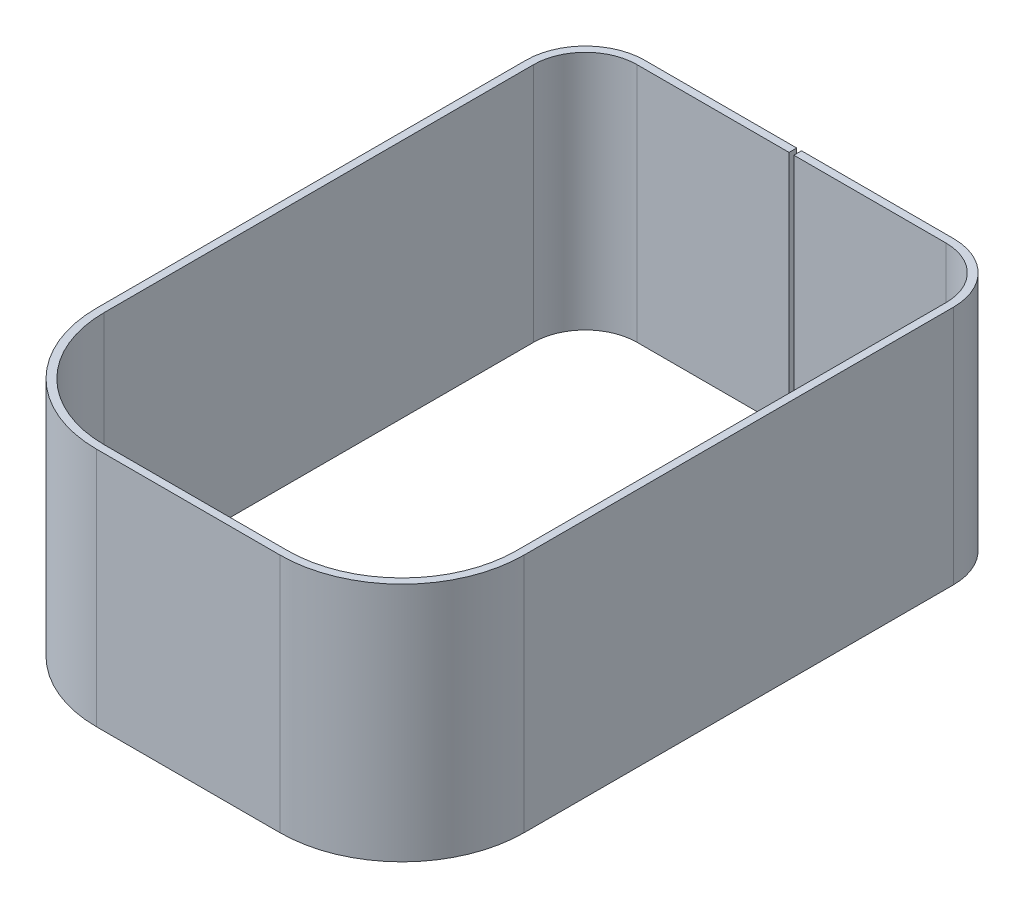
from build123d import *

# Parameters (mm, degrees)
EXTRUDE_THIN1_DEPTH  = 30
CONVERT_SOLID1_START = -20
CONVERT_SOLID1_DEPTH = 20


# Read off the part's stored shape, not the designer's step: Convert-Solid1
with BuildPart() as part:
    # Sketch1 → Extrude-Thin1 (new body)
    with BuildSketch(Plane(origin=(0, 0, 0), x_dir=(1, 0, 0), z_dir=(0, 1, 0))):
        with BuildLine():
            Line((0.5, 63.5), (32.11260948, 63.5))
            ThreePointArc((32.11260948, 63.5), (40.836461979, 59.886461979), (44.45, 51.16260948))
            Line((44.45, 51.16260948), (44.45, -38.1))
            ThreePointArc((44.45, -38.1), (37.010512242, -56.060512242), (19.05, -63.5))
            Line((19.05, -63.5), (-19.05, -63.5))
            ThreePointArc((-19.05, -63.5), (-37.010512242, -56.060512242), (-44.45, -38.1))
            Line((-44.45, -38.1), (-44.45, 51.16260948))
            ThreePointArc((-44.45, 51.16260948), (-40.836461979, 59.886461979), (-32.11260948, 63.5))
            Line((-32.11260948, 63.5), (-0.5, 63.5))
            Line((-0.5, 63.5), (-0.5, 61.9125))
            Line((-0.5, 61.9125), (-32.11260948, 61.9125))
            ThreePointArc((-32.11260948, 61.9125), (-39.713929964, 58.763929964), (-42.8625, 51.16260948))
            Line((-42.8625, 51.16260948), (-42.8625, -38.1))
            ThreePointArc((-42.8625, -38.1), (-35.887980227, -54.937980227), (-19.05, -61.9125))
            Line((-19.05, -61.9125), (19.05, -61.9125))
            ThreePointArc((19.05, -61.9125), (35.887980227, -54.937980227), (42.8625, -38.1))
            Line((42.8625, -38.1), (42.8625, 51.16260948))
            ThreePointArc((42.8625, 51.16260948), (39.713929964, 58.763929964), (32.11260948, 61.9125))
            Line((32.11260948, 61.9125), (0.5, 61.9125))
            Line((0.5, 61.9125), (0.5, 63.5))
        make_face()
    extrude(amount=EXTRUDE_THIN1_DEPTH)

    # Convert-Solid1 outline → Convert-Solid1 (add)
    with BuildSketch(Plane(origin=(0, 0, 0), x_dir=(1, 0, 0), z_dir=(0, 1, 0)).offset(CONVERT_SOLID1_START)):
        with BuildLine():
            Line((0.5, 61.9125), (32.11260948, 61.9125))
            ThreePointArc((32.11260948, 61.9125), (39.713929964, 58.763929964), (42.8625, 51.16260948))
            Line((42.8625, 51.16260948), (42.8625, -38.1))
            ThreePointArc((42.8625, -38.1), (35.887980227, -54.937980227), (19.05, -61.9125))
            Line((19.05, -61.9125), (-19.05, -61.9125))
            ThreePointArc((-19.05, -61.9125), (-35.887980227, -54.937980227), (-42.8625, -38.1))
            Line((-42.8625, -38.1), (-42.8625, 51.16260948))
            ThreePointArc((-42.8625, 51.16260948), (-39.713929964, 58.763929964), (-32.11260948, 61.9125))
            Line((-32.11260948, 61.9125), (-0.5, 61.9125))
            Line((-0.5, 61.9125), (-0.5, 63.5))
            Line((-0.5, 63.5), (-32.11260948, 63.5))
            ThreePointArc((-32.11260948, 63.5), (-40.836461979, 59.886461979), (-44.45, 51.16260948))
            Line((-44.45, 51.16260948), (-44.45, -38.1))
            ThreePointArc((-44.45, -38.1), (-37.010512242, -56.060512242), (-19.05, -63.5))
            Line((-19.05, -63.5), (19.05, -63.5))
            ThreePointArc((19.05, -63.5), (37.010512242, -56.060512242), (44.45, -38.1))
            Line((44.45, -38.1), (44.45, 51.16260948))
            ThreePointArc((44.45, 51.16260948), (40.836461979, 59.886461979), (32.11260948, 63.5))
            Line((32.11260948, 63.5), (0.5, 63.5))
            Line((0.5, 63.5), (0.5, 61.9125))
        make_face()
    extrude(amount=CONVERT_SOLID1_DEPTH)


solid = part.part
